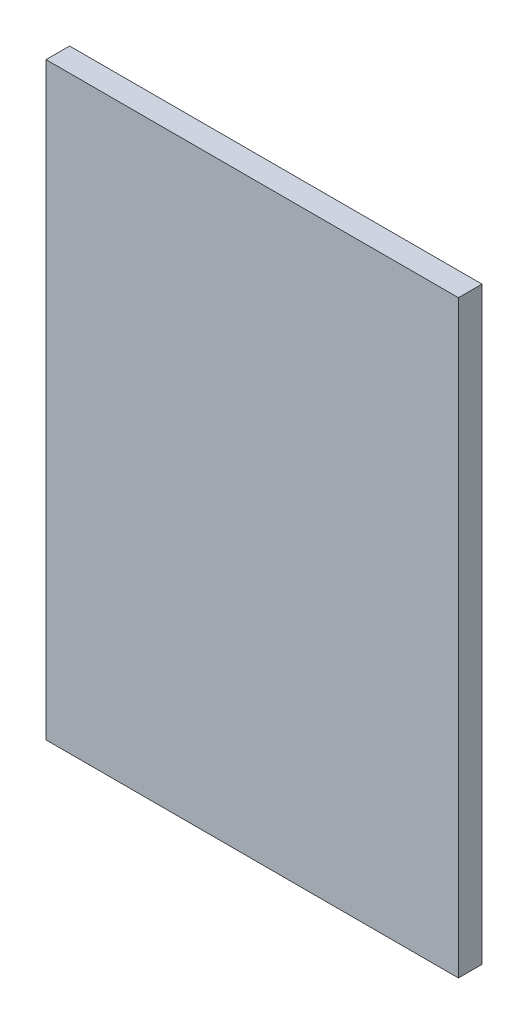
from build123d import *

# Parameters (mm, degrees)
SKETCH1_W           = 250
SKETCH1_H           = 175
BOSS_EXTRUDE1_DEPTH = 10


with BuildPart() as part:
    # Sketch1 → Boss-Extrude1 (new body)
    with BuildSketch(Plane(origin=(0, 0, 0), x_dir=(0, 1, 0), z_dir=(0, 0, 1))):
        Rectangle(SKETCH1_W, SKETCH1_H)
    extrude(amount=BOSS_EXTRUDE1_DEPTH)


solid = part.part
